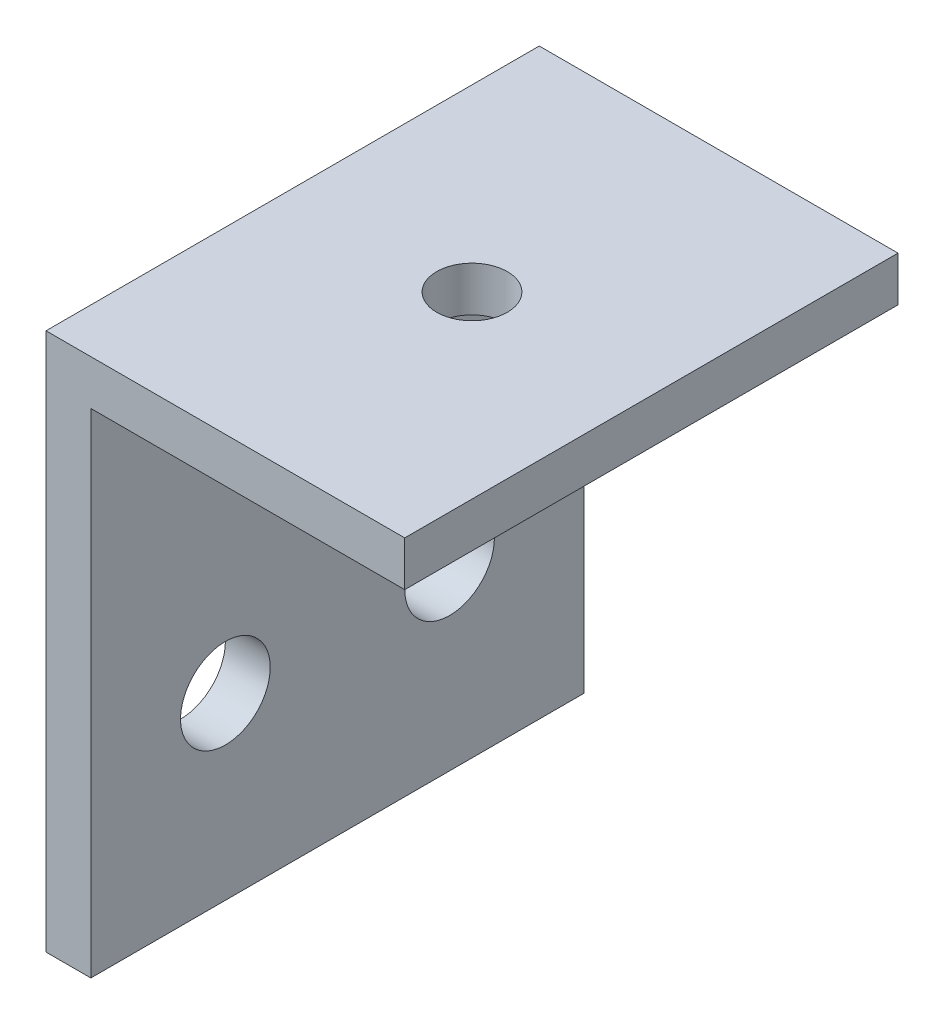
from build123d import *

# Parameters (mm, degrees)
BOSS_EXTRUDE1_DEPTH = 34.925
SKETCH2_R           = 3.175
CUT_EXTRUDE1_DEPTH  = 57.261143341
SKETCH3_R           = 2.5
CUT_EXTRUDE2_DEPTH  = 58.589283942


with BuildPart() as part:
    # Sketch1 → Boss-Extrude1 (new body)
    with BuildSketch(Plane.XY):
        Polygon((0, 0), (3.175, 0), (3.175, 34.925), (25.4, 34.925), (25.4, 38.1), (0, 38.1), align=None)
    extrude(amount=BOSS_EXTRUDE1_DEPTH)

    # Sketch2 → Cut-Extrude1 (cut, through all)
    with BuildSketch(Plane(origin=(3.175, 0, 0), x_dir=(0, 0, -1), z_dir=(1, 0, 0))):
        with Locations((-25.4, 12.7)):
            Circle(SKETCH2_R)
        with Locations((-9.525, 12.7)):
            Circle(SKETCH2_R)
    extrude(amount=-CUT_EXTRUDE1_DEPTH, mode=Mode.SUBTRACT)

    # Sketch3 → Cut-Extrude2 (cut, through all)
    with BuildSketch(Plane(origin=(0, 38.1, 0), x_dir=(1, 0, 0), z_dir=(0, 1, 0))):
        with Locations((12.7, -17.4625)):
            Circle(SKETCH3_R)
    extrude(amount=-CUT_EXTRUDE2_DEPTH, mode=Mode.SUBTRACT)


solid = part.part
